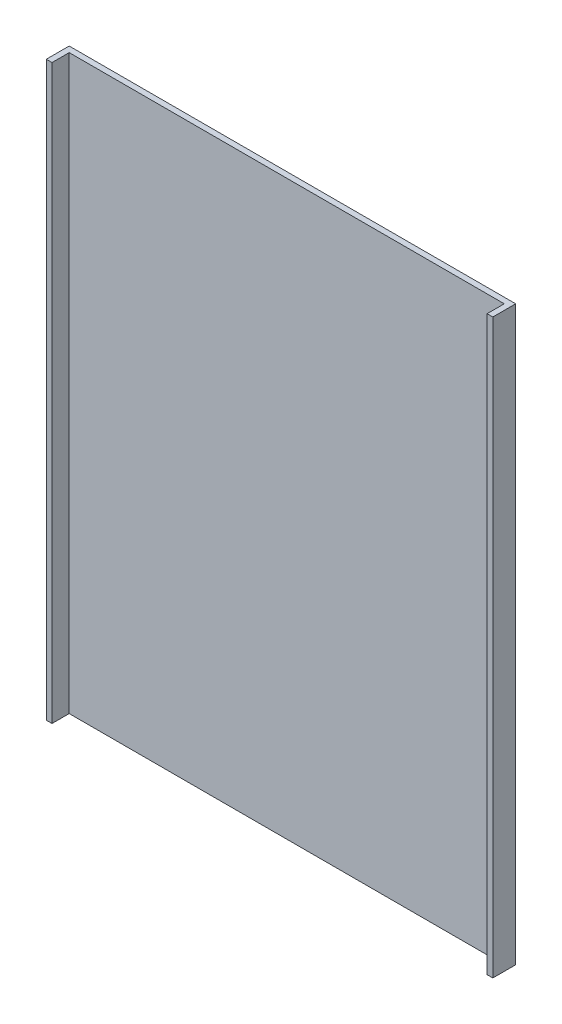
from build123d import *

# Parameters (mm, degrees)
AUFSATZ_LINEAR_AUSTRAGEN1_DEPTH = 1000


with BuildPart() as part:
    # Skizze1 → Aufsatz-Linear austragen1 (new body)
    with BuildSketch(Plane(origin=(0, 0, 0), x_dir=(1, 0, 0), z_dir=(0, 1, 0))):
        Polygon((0, 0), (10, 0), (10, 30), (770, 30), (770, 0), (780, 0), (780, 40), (0, 40), align=None)
    extrude(amount=AUFSATZ_LINEAR_AUSTRAGEN1_DEPTH)


solid = part.part
